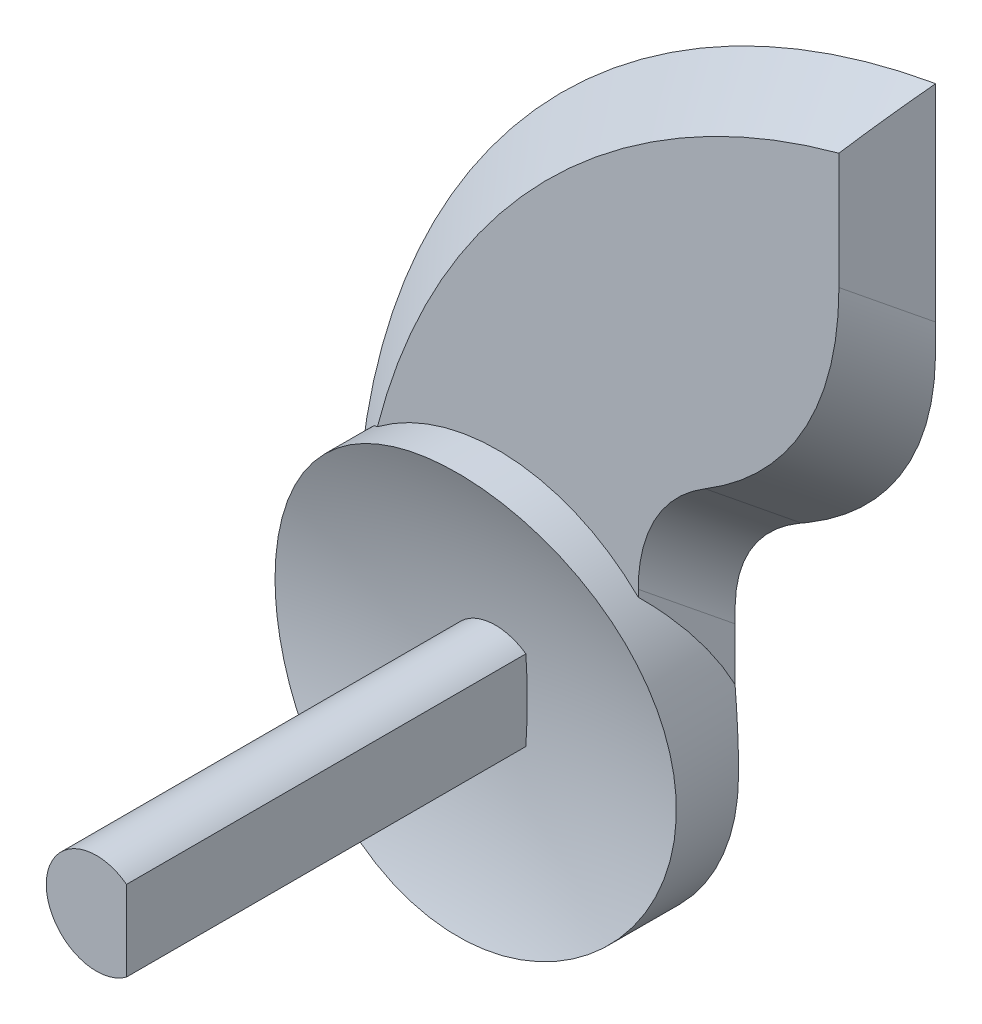
from build123d import *
from OCP.BRepFilletAPI import BRepFilletAPI_MakeChamfer
from build123d.topology import SkipClean

# Parameters (mm, degrees)
SKETCH1_R           = 10
BOSS_EXTRUDE1_DEPTH = 4
CHAMFER1_SIZE       = 2
CHAMFER1_SIZE2      = 2.856296013
SKETCH3_R           = 10
BOSS_EXTRUDE2_DEPTH = 2
CHAMFER2_SIZE       = 3
BOSS_EXTRUDE3_DEPTH = 24
SKETCH6_R           = 7.143703987
BOSS_EXTRUDE4_DEPTH = 2
CHAMFER3_SIZE2      = 3.464101615
CHAMFER3_SIZE       = 2
FILLET1_R           = 10
FILLET2_R           = 20


# Some blends are built 0.0001 mm under size
with BuildPart() as part:
    # Sketch1 → Boss-Extrude1 (new body)
    with BuildSketch(Plane.XY):
        with BuildLine():
            ThreePointArc((-10, 0), (0, 10), (10, 0))
            Line((10, 0), (10, 10))
            Line((10, 10), (20, 15))
            Line((20, 15), (20, 35))
            ThreePointArc((20, 35), (-1.473671334, 23.048861143), (-10, 0))
        make_face()
        Circle(SKETCH1_R)
    extrude(amount=BOSS_EXTRUDE1_DEPTH)

    # Chamfer1: one chamfer whose edges measure the first distance from different faces: ONE call of the kernel's chamfer builder (chamfer() names one face for all edges)
    chamfer1_edges_1 = [part.edges().sort_by_distance(p)[0] for p in [
        (20, 25, 0),
    ]]
    chamfer1_side_1 = [part.faces().sort_by_distance(p)[0] for p in [
        (20, 25, 2),
    ]]
    chamfer1_edges_2 = [part.edges().sort_by_distance(p)[0] for p in [
        (15, 12.5, 0),
    ]]
    chamfer1_side_2 = [part.faces().sort_by_distance(p)[0] for p in [
        (15, 12.5, 2),
    ]]
    chamfer1_edges_3 = [part.edges().sort_by_distance(p)[0] for p in [
        (10, 5, 0),
    ]]
    chamfer1_side_3 = [part.faces().sort_by_distance(p)[0] for p in [
        (10, 5, 2),
    ]]
    chamfer1_edges_4 = [part.edges().sort_by_distance(p)[0] for p in [
        (0, -10, 0),
    ]]
    chamfer1_side_4 = [part.faces().sort_by_distance(p)[0] for p in [
        (0, -10, 2),
    ]]
    chamfer1_edges_5 = [part.edges().sort_by_distance(p)[0] for p in [
        (-1.473671334, 23.048861143, 0),
    ]]
    chamfer1_side_5 = [part.faces().sort_by_distance(p)[0] for p in [
        (-1.473671334, 23.048861143, 2),
    ]]
    chamfer1 = BRepFilletAPI_MakeChamfer(part.part.solid().wrapped)
    for e in chamfer1_edges_1:
        chamfer1.Add(CHAMFER1_SIZE, CHAMFER1_SIZE2, e.wrapped, chamfer1_side_1[0].wrapped)  # the first distance lies on this face
    for e in chamfer1_edges_2:
        chamfer1.Add(CHAMFER1_SIZE, CHAMFER1_SIZE2, e.wrapped, chamfer1_side_2[0].wrapped)  # the first distance lies on this face
    for e in chamfer1_edges_3:
        chamfer1.Add(CHAMFER1_SIZE, CHAMFER1_SIZE2, e.wrapped, chamfer1_side_3[0].wrapped)  # the first distance lies on this face
    for e in chamfer1_edges_4:
        chamfer1.Add(CHAMFER1_SIZE, CHAMFER1_SIZE2, e.wrapped, chamfer1_side_4[0].wrapped)  # the first distance lies on this face
    for e in chamfer1_edges_5:
        chamfer1.Add(CHAMFER1_SIZE, CHAMFER1_SIZE2, e.wrapped, chamfer1_side_5[0].wrapped)  # the first distance lies on this face
    add(Compound.cast(chamfer1.Shape()), mode=Mode.REPLACE)

    # Sketch3 → Boss-Extrude2 (add)
    with BuildSketch(Plane.XY.offset(4)):
        Circle(SKETCH3_R)
    extrude(amount=BOSS_EXTRUDE2_DEPTH)

    # Sketch4 → Cut-Revolve2 (revolve, cut)
    with SkipClean():  # the faces are left unmerged after this step: merging them gives an invalid solid
        with BuildSketch(Plane(origin=(0, 0, 0), x_dir=(0, 0, -1), z_dir=(1, 0, 0))):
            with BuildLine():
                Line((-50, 16.613247726), (-50, -16.613247726))
                ThreePointArc((-50, -16.613247726), (-4, 0), (-50, 16.613247726))
            make_face()
        revolve(axis=Axis((0, 16.613247726, 50), (0, -1, 0)), mode=Mode.SUBTRACT)

    # Chamfer2
    # the kernel refuses this chamfer: 3 mm, written as the material it takes off along each edge
    with BuildSketch(Plane(origin=(10, -7.715048964, 4), x_dir=(0, 0, -1), z_dir=(0, 1, 0))) as chamfer2_piece_1_section:
        Polygon((CHAMFER2_SIZE, 0), (0, CHAMFER2_SIZE), (0, 0), align=None)
    chamfer2_piece_1 = extrude(amount=25.430097928, mode=Mode.PRIVATE)
    chamfer2_piece_1 = chamfer2_piece_1 - Plane(origin=(0, 0, 4), x_dir=(1, 0, 0), z_dir=(0, 0, -1)) * Cylinder(10, 63, mode=Mode.PRIVATE)
    chamfer2_piece_1 = split(chamfer2_piece_1, bisect_by=Plane(origin=(5.786169814, 0.712611408, -5.422410742), z_dir=(0.316227766016838, -0.6324555320336757, 0.7071067811865477)), keep=Keep.TOP, mode=Mode.PRIVATE)
    add(chamfer2_piece_1, mode=Mode.SUBTRACT)
    with BuildSketch(Plane(origin=(3.099450427, 6.549725213, 4), x_dir=(-0.4472135954999581, 0.8944271909999159, 0), z_dir=(0.8944271909999159, 0.4472135954999581, 0))) as chamfer2_piece_2_section:
        Polygon((CHAMFER2_SIZE, 0), (0, -CHAMFER2_SIZE), (0, 0), align=None)
    chamfer2_piece_2 = extrude(amount=26.610437815, mode=Mode.PRIVATE)
    chamfer2_piece_2 = split(chamfer2_piece_2, bisect_by=Plane(origin=(5.049725213, 6.549725213, 5.950274787), z_dir=(0.7071067811865476, 0, 0.7071067811865476)), keep=Keep.TOP, mode=Mode.PRIVATE)
    add(chamfer2_piece_2, mode=Mode.SUBTRACT)
    with BuildSketch(Plane(origin=(20, 7.284951036, 4), x_dir=(-1, 0, 0), z_dir=(0, 1, 0))) as chamfer2_piece_3:
        Polygon((CHAMFER2_SIZE, 0), (0, -CHAMFER2_SIZE), (0, 0), align=None)
    extrude(amount=35.430097928, mode=Mode.SUBTRACT)
    with BuildSketch(Plane(origin=(25.416666667, 0, 4), x_dir=(0.06431969440635008, 0.9979293446489453, 0), z_dir=(0.9979293446489453, -0.06431969440635008, 0))) as chamfer2_piece_4_section:
        Polygon((35.416666667 - CHAMFER2_SIZE, 0), (35.416666667, -CHAMFER2_SIZE), (35.416666667, 0), align=None)
    chamfer2_piece_4 = revolve(axis=Axis((25.416666667, 0, 4), (0, 0, 1)), revolution_arc=114.912638668, mode=Mode.PRIVATE)
    chamfer2_piece_4 = chamfer2_piece_4 - Plane(origin=(0, 0, 4), x_dir=(1, 0, 0), z_dir=(0, 0, -1)) * Cylinder(10, 142, mode=Mode.PRIVATE)
    add(chamfer2_piece_4, mode=Mode.SUBTRACT)

    # Sketch5 → Boss-Extrude3 (add)
    with BuildSketch(Plane(origin=(0, 0, 0), x_dir=(-1, 0, 0), z_dir=(0, 0, -1))):
        with BuildLine():
            ThreePointArc((2.5, 0), (1.118033989, 2.236067977), (-1.5, 2))
            Line((-1.5, 2), (-1.5, -2))
            ThreePointArc((-1.5, -2), (1.118033989, -2.236067977), (2.5, 0))
        make_face()
    extrude(amount=-BOSS_EXTRUDE3_DEPTH)

    # Sketch6 → Boss-Extrude4 (add)
    with BuildSketch(Plane(origin=(0, 0, 0), x_dir=(-1, 0, 0), z_dir=(0, 0, -1))):
        Circle(SKETCH6_R)
    extrude(amount=BOSS_EXTRUDE4_DEPTH)

    # Chamfer3
    chamfer3_edges = [part.edges().sort_by_distance(p)[0] for p in [
        (7.143703987, 0, -2),
    ]]
    chamfer3_side = [part.faces().sort_by_distance(p)[0] for p in [
        (7.143703987, 0, -1.96),
    ]]
    chamfer(chamfer3_edges, length=CHAMFER3_SIZE - 0.0001, length2=CHAMFER3_SIZE2 - 0.0001, reference=chamfer3_side[0])  # a hair under: the kernel refuses the full size

    # Fillet1
    # the kernel refuses this fillet: 10 mm, written as the material it adds along each edge
    with BuildSketch(Plane(origin=(15.19031869, 6.792206637, 5.634300272), x_dir=(-0.36999358405013405, -0.8921806391504057, -0.25907229664113096), z_dir=(-0.7308315944351151, 0.4516787654131792, -0.5117337915852868))) as fillet1_piece_1_section:
        with BuildLine():
            CenterArc((FILLET1_R * 0.316268876392, -FILLET1_R), FILLET1_R, 90, 35.101083815)
            Line((-FILLET1_R * 0.258751851785, -FILLET1_R * 0.181861159602), (0, 0))
            Line((0, 0), (FILLET1_R * 0.316268876392, 0))
        make_face()
    fillet1_piece_1 = extrude(amount=18.916939263, mode=Mode.PRIVATE)
    fillet1_piece_1 = split(fillet1_piece_1, bisect_by=Plane(origin=(10.278009209, 6.792206637, 0.721990791), z_dir=(0.7071067811865476, 0, 0.7071067811865476)), keep=Keep.TOP, mode=Mode.PRIVATE)
    fillet1_piece_1 = split(fillet1_piece_1, bisect_by=Plane(origin=(12.993467105, 11.185909808, 0.721990791), z_dir=(-0.31622776601683794, 0.6324555320336759, -0.7071067811865477)), keep=Keep.TOP, mode=Mode.PRIVATE)
    add(fillet1_piece_1)
    with BuildSketch(Plane(origin=(15.19031869, 6.792206637, 5.634300272), x_dir=(-0.36999358405013405, -0.8921806391504057, -0.25907229664113096), z_dir=(-0.7308315944351151, 0.4516787654131792, -0.5117337915852868))) as fillet1_piece_2_section:
        with BuildLine():
            CenterArc((FILLET1_R * 0.316268876392, -FILLET1_R), FILLET1_R, 90, 35.101083815)
            Line((-FILLET1_R * 0.258751851785, -FILLET1_R * 0.181861159602), (0, 0))
            Line((0, 0), (FILLET1_R * 0.316268876392, 0))
        make_face()
    fillet1_piece_2 = extrude(amount=18.916939263, mode=Mode.PRIVATE)
    fillet1_piece_2 = split(fillet1_piece_2, bisect_by=Plane(origin=(10.278009209, 6.792206637, 0.721990791), z_dir=(-0.7071067811865476, 0, -0.7071067811865476)), keep=Keep.TOP, mode=Mode.PRIVATE)
    fillet1_piece_2 = split(fillet1_piece_2, bisect_by=Plane(origin=(12.993467105, 11.185909808, 0.721990791), z_dir=(0.31622776601683794, -0.6324555320336759, 0.7071067811865477)), keep=Keep.TOP, mode=Mode.PRIVATE)
    add(fillet1_piece_2)
    with BuildSketch(Plane(origin=(15.19031869, 6.792206637, 5.634300272), x_dir=(-0.36999358405013405, -0.8921806391504057, -0.25907229664113096), z_dir=(-0.7308315944351151, 0.4516787654131792, -0.5117337915852868))) as fillet1_piece_3_section:
        with BuildLine():
            CenterArc((FILLET1_R * 0.316268876392, -FILLET1_R), FILLET1_R, 90, 35.101083815)
            Line((-FILLET1_R * 0.258751851785, -FILLET1_R * 0.181861159602), (0, 0))
            Line((0, 0), (FILLET1_R * 0.316268876392, 0))
        make_face()
    fillet1_piece_3 = extrude(amount=18.916939263, mode=Mode.PRIVATE)
    fillet1_piece_3 = split(fillet1_piece_3, bisect_by=Plane(origin=(15.19031869, 6.792206637, 0), z_dir=(0, 0, 1)), keep=Keep.TOP, mode=Mode.PRIVATE)
    fillet1_piece_3 = split(fillet1_piece_3, bisect_by=Plane(origin=(10.278009209, 6.792206637, 0.721990791), z_dir=(-0.7071067811865476, 0, -0.7071067811865476)), keep=Keep.TOP, mode=Mode.PRIVATE)
    fillet1_piece_3 = split(fillet1_piece_3, bisect_by=Plane(origin=(12.993467105, 11.185909808, 0.721990791), z_dir=(-0.31622776601683794, 0.6324555320336759, -0.7071067811865477)), keep=Keep.TOP, mode=Mode.PRIVATE)
    add(fillet1_piece_3)
    with BuildSketch(Plane(origin=(0.513404622, 15.863038381, 10.486595378), x_dir=(-0.28315848617955147, -0.9163201096827513, 0.283158486179551), z_dir=(0.6479361632942746, -0.40044657145615603, -0.6479361632942746))) as fillet1_piece_4_section:
        with BuildLine():
            CenterArc((FILLET1_R * 0.400446571456, -FILLET1_R), FILLET1_R, 90, 43.646927109)
            Line((-FILLET1_R * 0.289765861241, -FILLET1_R * 0.27639320225), (0, 0))
            Line((0, 0), (FILLET1_R * 0.400446571456, 0))
        make_face()
    fillet1_piece_4 = extrude(amount=23.744665195, mode=Mode.PRIVATE)
    fillet1_piece_4 = split(fillet1_piece_4, bisect_by=Plane(origin=(7.621794482, 15.863038381, 0.334762569), z_dir=(-0.5735764363510445, 0, 0.819152044288993)), keep=Keep.TOP, mode=Mode.PRIVATE)
    fillet1_piece_4 = split(fillet1_piece_4, bisect_by=Plane(origin=(3.692373209, 9.505101206, 0.334762569), z_dir=(-0.2565111803946036, 0.5130223607892069, 0.8191520442889928)), keep=Keep.TOP, mode=Mode.PRIVATE)
    fillet1_piece_4 = split(fillet1_piece_4, bisect_by=Plane(origin=(0.513404622, 15.863038381, 4), z_dir=(0, 0, -1)), keep=Keep.TOP, mode=Mode.PRIVATE)
    add(fillet1_piece_4)
    with BuildSketch(Plane(origin=(0.513404622, 15.863038381, 10.486595378), x_dir=(-0.28315848617955147, -0.9163201096827513, 0.283158486179551), z_dir=(0.6479361632942746, -0.40044657145615603, -0.6479361632942746))) as fillet1_piece_5_section:
        with BuildLine():
            CenterArc((FILLET1_R * 0.400446571456, -FILLET1_R), FILLET1_R, 90, 43.646927109)
            Line((-FILLET1_R * 0.289765861241, -FILLET1_R * 0.27639320225), (0, 0))
            Line((0, 0), (FILLET1_R * 0.400446571456, 0))
        make_face()
    fillet1_piece_5 = extrude(amount=23.744665195, mode=Mode.PRIVATE)
    fillet1_piece_5 = split(fillet1_piece_5, bisect_by=Plane(origin=(7.621794482, 15.863038381, 0.334762569), z_dir=(0.5735764363510445, 0, -0.819152044288993)), keep=Keep.TOP, mode=Mode.PRIVATE)
    fillet1_piece_5 = split(fillet1_piece_5, bisect_by=Plane(origin=(3.692373209, 9.505101206, 0.334762569), z_dir=(-0.2565111803946036, 0.5130223607892069, 0.8191520442889928)), keep=Keep.TOP, mode=Mode.PRIVATE)
    add(fillet1_piece_5)
    with BuildSketch(Plane(origin=(0.513404622, 15.863038381, 10.486595378), x_dir=(-0.28315848617955147, -0.9163201096827513, 0.283158486179551), z_dir=(0.6479361632942746, -0.40044657145615603, -0.6479361632942746))) as fillet1_piece_6_section:
        with BuildLine():
            CenterArc((FILLET1_R * 0.400446571456, -FILLET1_R), FILLET1_R, 90, 43.646927109)
            Line((-FILLET1_R * 0.289765861241, -FILLET1_R * 0.27639320225), (0, 0))
            Line((0, 0), (FILLET1_R * 0.400446571456, 0))
        make_face()
    fillet1_piece_6 = extrude(amount=23.744665195, mode=Mode.PRIVATE)
    fillet1_piece_6 = split(fillet1_piece_6, bisect_by=Plane(origin=(7.621794482, 15.863038381, 0.334762569), z_dir=(-0.5735764363510445, 0, 0.819152044288993)), keep=Keep.TOP, mode=Mode.PRIVATE)
    fillet1_piece_6 = split(fillet1_piece_6, bisect_by=Plane(origin=(3.692373209, 9.505101206, 0.334762569), z_dir=(0.2565111803946036, -0.5130223607892069, -0.8191520442889928)), keep=Keep.TOP, mode=Mode.PRIVATE)
    add(fillet1_piece_6)
    with BuildSketch(Plane(origin=(15.19031869, 6.792206637, 5.634300272), x_dir=(-0.36999358405013405, -0.8921806391504057, -0.25907229664113096), z_dir=(-0.7308315944351151, 0.4516787654131792, -0.5117337915852868))) as fillet1_piece_7a_section:
        with BuildLine():
            CenterArc((FILLET1_R * 0.316268876392, -FILLET1_R), FILLET1_R, 90, 35.101083815)
            Line((-FILLET1_R * 0.258751851785, -FILLET1_R * 0.181861159602), (0, 0))
            Line((0, 0), (FILLET1_R * 0.316268876392, 0))
        make_face()
    fillet1_piece_7a = extrude(amount=18.916939263, mode=Mode.PRIVATE)
    fillet1_piece_7a = split(fillet1_piece_7a, bisect_by=Plane(origin=(10.278009209, 6.792206637, 0.721990791), z_dir=(0.7071067811865476, 0, 0.7071067811865476)), keep=Keep.TOP, mode=Mode.PRIVATE)
    fillet1_piece_7a = split(fillet1_piece_7a, bisect_by=Plane(origin=(12.993467105, 11.185909808, 0.721990791), z_dir=(0.31622776601683794, -0.6324555320336759, 0.7071067811865477)), keep=Keep.TOP, mode=Mode.PRIVATE)
    with BuildSketch(Plane(origin=(0.513404622, 15.863038381, 10.486595378), x_dir=(-0.28315848617955147, -0.9163201096827513, 0.283158486179551), z_dir=(0.6479361632942746, -0.40044657145615603, -0.6479361632942746))) as fillet1_piece_7b_section:
        with BuildLine():
            CenterArc((FILLET1_R * 0.400446571456, -FILLET1_R), FILLET1_R, 90, 43.646927109)
            Line((-FILLET1_R * 0.289765861241, -FILLET1_R * 0.27639320225), (0, 0))
            Line((0, 0), (FILLET1_R * 0.400446571456, 0))
        make_face()
    fillet1_piece_7b = extrude(amount=23.744665195, mode=Mode.PRIVATE)
    fillet1_piece_7b = split(fillet1_piece_7b, bisect_by=Plane(origin=(7.621794482, 15.863038381, 0.334762569), z_dir=(0.5735764363510445, 0, -0.819152044288993)), keep=Keep.TOP, mode=Mode.PRIVATE)
    fillet1_piece_7b = split(fillet1_piece_7b, bisect_by=Plane(origin=(3.692373209, 9.505101206, 0.334762569), z_dir=(0.2565111803946036, -0.5130223607892069, -0.8191520442889928)), keep=Keep.TOP, mode=Mode.PRIVATE)
    fillet1_piece_7 = fillet1_piece_7a & fillet1_piece_7b
    add(fillet1_piece_7)

    # Fillet2
    # the kernel refuses this fillet: 20 mm, written as the material it takes off along each edge
    with BuildSketch(Plane(origin=(30.96880087, 8.220908247, 9.680437054), x_dir=(-0.6325244619050064, -0.7299276335395035, 0.2590722966416945), z_dir=(-0.7308315944351149, 0.4516787654131793, -0.5117337915852869))) as fillet2_piece_1:
        with BuildLine():
            CenterArc((FILLET2_R * 0.316268876392, FILLET2_R), FILLET2_R, 234.898916185, 35.101083815)
            Line((-FILLET2_R * 0.258751851784, FILLET2_R * 0.181861159603), (-FILLET2_R * 0.270252266348, FILLET2_R * 0.165498382795))
            Line((-FILLET2_R * 0.270252266348, FILLET2_R * 0.165498382795), (-FILLET2_R * 0.00632537752785, -FILLET2_R * 0.02))
            Line((-FILLET2_R * 0.00632537752785, -FILLET2_R * 0.02), (FILLET2_R * 0.316268876391, -FILLET2_R * 0.02))
            Line((FILLET2_R * 0.316268876391, -FILLET2_R * 0.02), (FILLET2_R * 0.316268876391, 0))
        make_face()
    extrude(amount=34.730383082, mode=Mode.SUBTRACT)
    with BuildSketch(Plane(origin=(32.254343694, 7.426399087, -11.254343694), x_dir=(0.28315848617949646, 0.9163201096827853, -0.2831584861794967), z_dir=(-0.6479361632942986, 0.40044657145607865, 0.6479361632942986))) as fillet2_piece_2:
        with BuildLine():
            CenterArc((7.92825461, 20), FILLET2_R, 229.844556223, 40.155443777)
            Line((-4.96901588, 4.714045208), (-6.258742929, 3.185449729))
            ThreePointArc((-6.258742929, 3.185449729), (-5.895951663, 2.859922194), (-1.380424865, -1.447213595))
            Line((-1.380424865, -1.447213595), (0, -2))
            Line((0, -2), (7.92825461, -2))
            Line((7.92825461, -2), (7.92825461, 0))
        make_face()
    extrude(amount=43.363609674, mode=Mode.SUBTRACT)


solid = part.part
